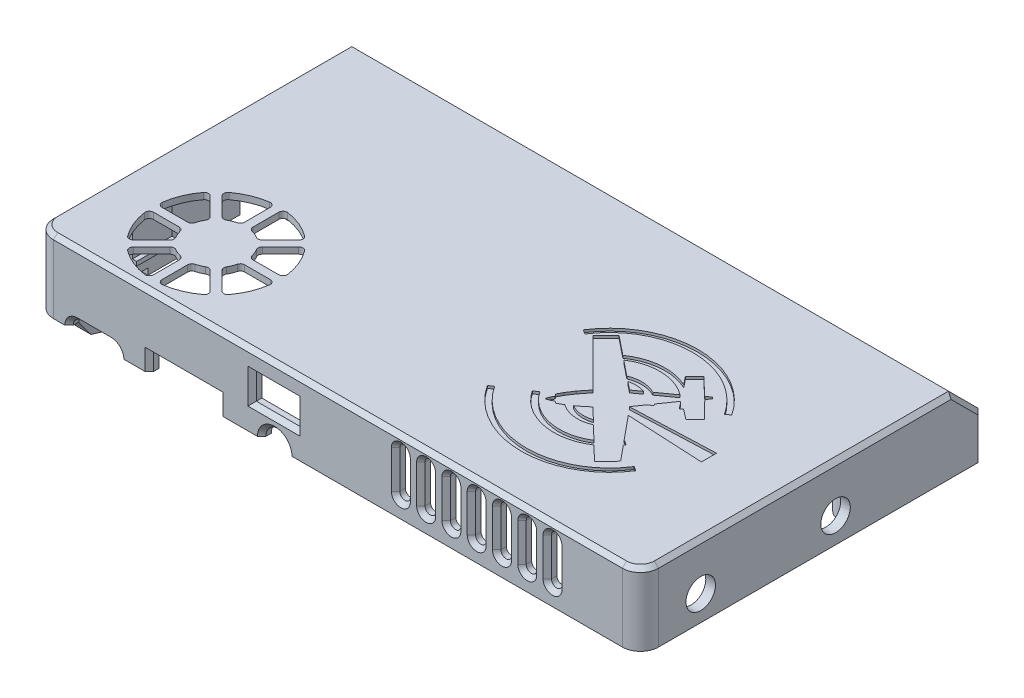
from build123d import *
from OCP.BRepFilletAPI import BRepFilletAPI_MakeChamfer

# Parameters (mm, degrees)
SKETCH3_W                      = 143.6
SKETCH3_H                      = 81.1
SKETCH3_W_2                    = 139
SKETCH3_H_2                    = 76.5
BOSS_EXTRUDE1_DEPTH            = 17.2
CUT_EXTRUDE1_REACH             = 113.702
SKETCH11_R                     = 3.1
SKETCH11_W                     = 12
SKETCH11_H                     = 2
SKETCH11_W_2                   = 16.5
SKETCH11_H_2                   = 4
SKETCH14_W                     = 2.3
SKETCH14_H                     = 30
BOSS_EXTRUDE6_DEPTH            = 2.8
SKETCH94_W                     = 2.3
SKETCH94_H                     = 13.507377528
BOSS_EXTRUDE11_DEPTH           = 1.5
SKETCH35_W                     = 139
SKETCH35_H                     = 76.5
BOSS_EXTRUDE7_DEPTH            = 2
CUT_EXTRUDE4_DEPTH             = 0.6
CUT_EXTRUDE5_DEPTH             = 0.6
BOSS_EXTRUDE9_START            = -17.2
SKETCH48_R                     = 4.3
BOSS_EXTRUDE9_DEPTH            = 15.2
BOSS_EXTRUDE10_DEPTH           = 18.3
FILLET15_R                     = 4.3
CUT_EXTRUDE19_REACH            = 155.999
SKETCH68_R                     = 3.5
CUT_EXTRUDE20_DEPTH            = 2.3
FILLET24_R                     = 2
FILLET25_R                     = 2
FILLET26_R                     = 2
CHAMFER1_SIZE                  = 1
FILLET51_R                     = 3
CHAMFER3_SIZE                  = 2
CHAMFER3_SIZE2                 = 2.965121937
F_2_3_2_3_DIAMETER_HOLE2_D     = 2.3
F_2_3_2_3_DIAMETER_HOLE2_DEPTH = 12
F_2_3_2_3_DIAMETER_HOLE1_D     = 2.3
F_2_3_2_3_DIAMETER_HOLE1_DEPTH = 13
CHAMFER4_SIZE                  = 1
CUT_EXTRUDE21_REACH            = 155.999
SKETCH95_W                     = 10
SKETCH95_H                     = 4
FILLET52_R                     = 1
CHAMFER5_SIZE                  = 1
SKETCH96_W                     = 30.5
SKETCH96_H                     = 30.5
CUT_EXTRUDE22_DEPTH            = 0.5
CUT_EXTRUDE23_REACH            = 95.826
SKETCH98_W                     = 2
SKETCH98_H                     = 9.383141043
BOSS_EXTRUDE12_DEPTH           = 7.5
SKETCH100_W                    = 9.383141043
SKETCH100_H                    = 1
BOSS_EXTRUDE13_DEPTH           = 1
SKETCH101_W                    = 9.383141043
SKETCH101_H                    = 1
BOSS_EXTRUDE14_DEPTH           = 1
SKETCH103_W                    = 139
SKETCH103_H                    = 1.5
BOSS_EXTRUDE24_DEPTH           = 15.2
CHAMFER6_SIZE                  = 1
CHAMFER7_SIZE                  = 1
SKETCH105_W                    = 2
SKETCH105_H                    = 18.5
BOSS_EXTRUDE25_DEPTH           = 15.2
SKETCH106_W                    = 1.127231504
SKETCH106_H                    = 6.675258223
SKETCH106_W_2                  = 1
SKETCH106_H_2                  = 18.5
BOSS_EXTRUDE26_DEPTH           = 8
CUT_EXTRUDE24_DEPTH            = 1.127231504
CUT_EXTRUDE25_START            = -1.127231504
CUT_EXTRUDE25_DEPTH            = 1.127231504
CHAMFER8_SIZE                  = 7
CHAMFER9_SIZE                  = 6
SKETCH115_W                    = 13
SKETCH115_H                    = 5
BOSS_EXTRUDE27_DEPTH           = 12
SKETCH116_R                    = 3.1
CUT_EXTRUDE29_DEPTH            = 100.406911394
SKETCH117_W                    = 10.361754238
SKETCH117_H                    = 6.2
CUT_EXTRUDE30_DEPTH            = 2.3
CHAMFER10_SIZE                 = 1
CHAMFER11_SIZE                 = 1
CHAMFER12_SIZE                 = 1


with BuildPart() as part:
    # Sketch3 → Boss-Extrude1 (new body)
    with BuildSketch(Plane(origin=(0, 0, 0), x_dir=(1, 0, 0), z_dir=(0, 1, 0))):
        with Locations((-3.061766162, 12.355993834)):
            Rectangle(SKETCH3_W, SKETCH3_H)
        with Locations((-3.061766162, 12.355993834)):
            Rectangle(SKETCH3_W_2, SKETCH3_H_2, mode=Mode.SUBTRACT)
    extrude(amount=BOSS_EXTRUDE1_DEPTH)

    # Sketch11 → Cut-Extrude1 (cut, up to next)
    with BuildSketch(Plane.XY.offset(28.194006166), mode=Mode.PRIVATE) as cut_extrude1_sk1:
        with Locations((-18.061766162, 0)):
            Circle(SKETCH11_R)
    cut_extrude1_tool1 = extrude(cut_extrude1_sk1.sketch, amount=-CUT_EXTRUDE1_REACH, mode=Mode.PRIVATE) & part.part
    # Sketch11 → Cut-Extrude1 (cut, up to next)
    with BuildSketch(Plane.XY.offset(28.194006166), mode=Mode.PRIVATE) as cut_extrude1_sk2:
        with Locations((-60.861766162, 1)):
            Rectangle(SKETCH11_W, SKETCH11_H)
    cut_extrude1_tool2 = extrude(cut_extrude1_sk2.sketch, amount=-CUT_EXTRUDE1_REACH, mode=Mode.PRIVATE) & part.part
    # Sketch11 → Cut-Extrude1 (cut, up to next)
    with BuildSketch(Plane.XY.offset(28.194006166), mode=Mode.PRIVATE) as cut_extrude1_sk3:
        with Locations((-39.561766162, 2)):
            Rectangle(SKETCH11_W_2, SKETCH11_H_2)
    cut_extrude1_tool3 = extrude(cut_extrude1_sk3.sketch, amount=-CUT_EXTRUDE1_REACH, mode=Mode.PRIVATE) & part.part
    add(cut_extrude1_tool1.solids().sort_by_distance((-18.061766, 0, 28.194006))[0], mode=Mode.SUBTRACT)
    add(cut_extrude1_tool2.solids().sort_by_distance((-60.861766, 1, 28.194006))[0], mode=Mode.SUBTRACT)
    add(cut_extrude1_tool3.solids().sort_by_distance((-39.561766, 2, 28.194006))[0], mode=Mode.SUBTRACT)

    # Sketch14 → Boss-Extrude6 (add)
    with BuildSketch(Plane.XZ):
        with Locations((-73.711766162, -3.105993834)):
            Rectangle(SKETCH14_W, SKETCH14_H)
    extrude(amount=BOSS_EXTRUDE6_DEPTH)

    # Sketch94 → Boss-Extrude11 (add)
    with BuildSketch(Plane.XZ.offset(2.8)):
        with Locations((-73.711766162, -2.986611136)):
            Rectangle(SKETCH94_W, SKETCH94_H)
    extrude(amount=BOSS_EXTRUDE11_DEPTH)

    # Sketch35 → Boss-Extrude7 (add)
    with BuildSketch(Plane(origin=(0, 17.2, 0), x_dir=(1, 0, 0), z_dir=(0, 1, 0))):
        with Locations((-3.061766162, 12.355993834)):
            Rectangle(SKETCH35_W, SKETCH35_H)
    extrude(amount=-BOSS_EXTRUDE7_DEPTH)

    # Sketch36 → Cut-Extrude4 (cut)
    with BuildSketch(Plane(origin=(0, 17.2, 0), x_dir=(1, 0, 0), z_dir=(0, 1, 0))):
        with BuildLine():
            Line((24.161779637, 0.392233192), (23.011912593, -0.357872059))
            ThreePointArc((23.011912593, -0.357872059), (29.415585328, -3.817531293), (35.804632502, -0.330936576))
            Line((35.804632502, -0.330936576), (34.651616926, 0.414319881))
            ThreePointArc((34.651616926, 0.414319881), (29.412694651, -2.444635175), (24.161779637, 0.392233192))
        make_face()
        with BuildLine():
            Line((24.14743779, 7.203740161), (22.994422214, 7.948996618))
            ThreePointArc((22.994422214, 7.948996618), (29.383469388, 11.435591335), (35.787142123, 7.975932102))
            Line((35.787142123, 7.975932102), (34.63727508, 7.22582685))
            ThreePointArc((34.63727508, 7.22582685), (29.386360065, 10.062695217), (24.14743779, 7.203740161))
        make_face()
        with BuildLine():
            Line((45.948925277, -6.887742795), (46.992328784, -7.562151032))
            ThreePointArc((46.992328784, -7.562151032), (29.443633532, -17.13872583), (11.854766481, -7.636134299))
            Line((11.854766481, -7.636134299), (12.895320773, -6.957338222))
            ThreePointArc((12.895320773, -6.957338222), (29.441017659, -15.896344847), (45.948925277, -6.887742795))
        make_face()
        with BuildLine():
            Line((39.41741464, -2.666073477), (40.524480414, -3.381630087))
            ThreePointArc((40.524480414, -3.381630087), (29.427418261, -9.437456131), (18.30495314, -3.428414016))
            Line((18.30495314, -3.428414016), (19.408995856, -2.708201846))
            ThreePointArc((19.408995856, -2.708201846), (29.424642783, -8.119272462), (39.41741464, -2.666073477))
        make_face()
        with BuildLine():
            Line((12.850129439, 14.505802837), (11.806725932, 15.180211074))
            ThreePointArc((11.806725932, 15.180211074), (29.355421185, 24.756785872), (46.944288235, 15.254194341))
            Line((46.944288235, 15.254194341), (45.903733944, 14.575398264))
            ThreePointArc((45.903733944, 14.575398264), (29.358037058, 23.51440489), (12.850129439, 14.505802837))
        make_face()
        with BuildLine():
            Line((19.381640076, 10.284133519), (18.274574303, 10.999690129))
            ThreePointArc((18.274574303, 10.999690129), (29.371636456, 17.055516173), (40.494101577, 11.046474058))
            Line((40.494101577, 11.046474058), (39.39005886, 10.326261888))
            ThreePointArc((39.39005886, 10.326261888), (29.374411934, 15.737332504), (19.381640076, 10.284133519))
        make_face()
        Polygon((52.970409368, 2.032871576), (31.272458716, 3.1100748), (31.272458716, 4.751527332), (52.970409368, 5.623548989), align=None)
    extrude(amount=-CUT_EXTRUDE4_DEPTH, mode=Mode.SUBTRACT)

    # Sketch37 → Cut-Extrude5 (cut)
    with BuildSketch(Plane(origin=(0, 17.2, 0), x_dir=(1, 0, 0), z_dir=(0, 1, 0))):
        Polygon((28.805009981, 0.4761393), (40.182569063, -10.556645264), (43.238384097, -7.405336011), (33.094377004, 4.899549043), (38.166380551, 12.198472901), (42.417591065, 8.902411722), (44.568940225, 11.120990543), (40.544894779, 15.266245054), (41.344156493, 16.297120883), (41.114611999, 16.475092003), (40.933368387, 16.702061489), (39.914056825, 15.888103135), (35.711539041, 19.852308098), (33.524030257, 17.669374175), (36.880698648, 13.465853336), (29.655237827, 8.289732648), (17.206191432, 18.256292734), (14.099014617, 15.155614134), (25.293775626, 3.93739182), (23.594988453, 1.815468092), (22.403600711, 0.012444552), (21.719985048, -1.305503792), (22.078414673, -1.805843596), (21.679059506, -2.575763756), (21.459015457, -3.268829783), (21.461778406, -3.461536167), (21.654504596, -3.461536167), (22.344344816, -3.231578841), (23.108460643, -2.821227033), (23.613887524, -3.172446882), (24.921900017, -2.470007184), (26.707658365, -1.252893484), align=None)
    extrude(amount=-CUT_EXTRUDE5_DEPTH, mode=Mode.SUBTRACT)

    # Sketch48 → Boss-Extrude9 (add)
    with BuildSketch(Plane(origin=(0, 17.2, 0), x_dir=(1, 0, 0), z_dir=(0, 1, 0)).offset(BOSS_EXTRUDE9_START)):
        with Locations((64.438233838, 27.805993834)):
            Circle(SKETCH48_R)
        with Locations((64.438233838, -23.894006166)):
            Circle(SKETCH48_R)
    extrude(amount=BOSS_EXTRUDE9_DEPTH)

    # Sketch87 → Boss-Extrude10 (add)
    with BuildSketch(Plane.XZ.offset(-15.2)):
        with BuildLine():
            ThreePointArc((-65.061766162, -27.605993834), (-65.940445819, -25.484673491), (-68.061766162, -24.605993834))
            Line((-68.061766162, -24.605993834), (-72.561766162, -24.605993834))
            Line((-72.561766162, -24.605993834), (-72.561766162, -30.605993834))
            Line((-72.561766162, -30.605993834), (-65.061766162, -30.605993834))
            Line((-65.061766162, -30.605993834), (-65.061766162, -27.605993834))
        make_face()
        with BuildLine():
            ThreePointArc((-7.061766162, -27.605993834), (-10.061766162, -24.605993834), (-13.061766162, -27.605993834))
            Line((-13.061766162, -27.605993834), (-13.061766162, -30.605993834))
            Line((-13.061766162, -30.605993834), (-7.061766162, -30.605993834))
            Line((-7.061766162, -30.605993834), (-7.061766162, -27.605993834))
        make_face()
        with BuildLine():
            Line((-13.061766162, 25.894006166), (-13.061766162, 21.394006166))
            ThreePointArc((-13.061766162, 21.394006166), (-10.061766162, 18.394006166), (-7.061766162, 21.394006166))
            Line((-7.061766162, 21.394006166), (-7.061766162, 25.894006166))
            Line((-7.061766162, 25.894006166), (-13.061766162, 25.894006166))
        make_face()
        with BuildLine():
            Line((-65.141523152, 22.08116027), (-66.861766162, 25.894006166))
            Line((-66.861766162, 25.894006166), (-72.561766162, 25.894006166))
            Line((-72.561766162, 25.894006166), (-72.561766162, 18.394006166))
            Line((-72.561766162, 18.394006166), (-68.061766162, 18.394006166))
            ThreePointArc((-68.061766162, 18.394006166), (-65.710015504, 19.531408828), (-65.141523152, 22.08116027))
        make_face()
    extrude(amount=BOSS_EXTRUDE10_DEPTH)

    # Fillet15
    fillet15_edges = [part.edges().sort_by_distance(p)[0] for p in [
        (68.738233838, 8.6, 28.194006166),
        (-74.861766162, 8.6, 28.194006166),
    ]]
    fillet(fillet15_edges, radius=FILLET15_R - 0.0001)  # a hair under: the kernel refuses the full size

    # Sketch68 → Cut-Extrude19 (cut, up to next)
    with BuildSketch(Plane(origin=(68.738233838, 0, 0), x_dir=(0, 0, -1), z_dir=(1, 0, 0)), mode=Mode.PRIVATE) as cut_extrude19_sk1:
        with Locations((-13.894006166, 6)):
            Circle(SKETCH68_R)
    cut_extrude19_tool1 = extrude(cut_extrude19_sk1.sketch, amount=-CUT_EXTRUDE19_REACH, mode=Mode.PRIVATE) & part.part
    # Sketch68 → Cut-Extrude19 (cut, up to next)
    with BuildSketch(Plane(origin=(68.738233838, 0, 0), x_dir=(0, 0, -1), z_dir=(1, 0, 0)), mode=Mode.PRIVATE) as cut_extrude19_sk2:
        with Locations((18.105993834, 6)):
            Circle(SKETCH68_R)
    cut_extrude19_tool2 = extrude(cut_extrude19_sk2.sketch, amount=-CUT_EXTRUDE19_REACH, mode=Mode.PRIVATE) & part.part
    add(cut_extrude19_tool1.solids().sort_by_distance((68.738234, 6, 13.894006))[0], mode=Mode.SUBTRACT)
    add(cut_extrude19_tool2.solids().sort_by_distance((68.738234, 6, -18.105994))[0], mode=Mode.SUBTRACT)

    # Sketch81 → Cut-Extrude20 (cut)
    with BuildSketch(Plane.XY.offset(28.194006166)):
        with BuildLine():
            Line((46.626025489, 4.603773013), (46.626025489, 13.603773013))
            ThreePointArc((46.626025489, 13.603773013), (47.876025489, 14.853773013), (49.126025489, 13.603773013))
            Line((49.126025489, 13.603773013), (49.126025489, 4.603773013))
            ThreePointArc((49.126025489, 4.603773013), (47.876025489, 3.353773013), (46.626025489, 4.603773013))
        make_face()
        with BuildLine():
            Line((40.626025489, 4.603773013), (40.626025489, 13.603773013))
            ThreePointArc((40.626025489, 13.603773013), (41.876025489, 14.853773013), (43.126025489, 13.603773013))
            Line((43.126025489, 13.603773013), (43.126025489, 4.603773013))
            ThreePointArc((43.126025489, 4.603773013), (41.876025489, 3.353773013), (40.626025489, 4.603773013))
        make_face()
        with BuildLine():
            Line((34.626025489, 4.603773013), (34.626025489, 13.603773013))
            ThreePointArc((34.626025489, 13.603773013), (35.876025489, 14.853773013), (37.126025489, 13.603773013))
            Line((37.126025489, 13.603773013), (37.126025489, 4.603773013))
            ThreePointArc((37.126025489, 4.603773013), (35.876025489, 3.353773013), (34.626025489, 4.603773013))
        make_face()
        with BuildLine():
            Line((28.626025489, 4.603773013), (28.626025489, 13.603773013))
            ThreePointArc((28.626025489, 13.603773013), (29.876025489, 14.853773013), (31.126025489, 13.603773013))
            Line((31.126025489, 13.603773013), (31.126025489, 4.603773013))
            ThreePointArc((31.126025489, 4.603773013), (29.876025489, 3.353773013), (28.626025489, 4.603773013))
        make_face()
        with BuildLine():
            Line((22.626025489, 4.603773013), (22.626025489, 13.603773013))
            ThreePointArc((22.626025489, 13.603773013), (23.876025489, 14.853773013), (25.126025489, 13.603773013))
            Line((25.126025489, 13.603773013), (25.126025489, 4.603773013))
            ThreePointArc((25.126025489, 4.603773013), (23.876025489, 3.353773013), (22.626025489, 4.603773013))
        make_face()
        with BuildLine():
            Line((16.626025489, 4.603773013), (16.626025489, 13.603773013))
            ThreePointArc((16.626025489, 13.603773013), (17.876025489, 14.853773013), (19.126025489, 13.603773013))
            Line((19.126025489, 13.603773013), (19.126025489, 4.603773013))
            ThreePointArc((19.126025489, 4.603773013), (17.876025489, 3.353773013), (16.626025489, 4.603773013))
        make_face()
        with BuildLine():
            Line((10.626025489, 4.603773013), (10.626025489, 13.603773013))
            ThreePointArc((10.626025489, 13.603773013), (11.876025489, 14.853773013), (13.126025489, 13.603773013))
            Line((13.126025489, 13.603773013), (13.126025489, 4.603773013))
            ThreePointArc((13.126025489, 4.603773013), (11.876025489, 3.353773013), (10.626025489, 4.603773013))
        make_face()
    extrude(amount=-CUT_EXTRUDE20_DEPTH, mode=Mode.SUBTRACT)

    # Fillet24
    fillet24_edges = [part.edges().sort_by_distance(p)[0] for p in [
        (60.631660576, 7.6, 25.894006166),
    ]]
    fillet(fillet24_edges, radius=FILLET24_R)

    # Fillet25
    fillet25_edges = [part.edges().sort_by_distance(p)[0] for p in [
        (-54.861766162, 2, 27.044006166),
    ]]
    fillet(fillet25_edges, radius=FILLET25_R - 0.0001)  # a hair under: the kernel refuses the full size

    # Fillet26
    fillet26_edges = [part.edges().sort_by_distance(p)[0] for p in [
        (-66.861766162, 2, 27.044006166),
    ]]
    fillet(fillet26_edges, radius=FILLET26_R - 0.0001)  # a hair under: the kernel refuses the full size

    # Chamfer1
    chamfer1_edges = [part.edges().sort_by_distance(p)[0] for p in [
        (-47.811766162, 2, 28.194006166),
        (-31.311766162, 2, 28.194006166),
        (-39.561766162, 4, 28.194006166),
        (-18.061766162, 3.1, 28.194006166),
        (-60.861766162, 2, 28.194006166),
        (-55.447523311, 1.414242852, 28.194006166),
        (-66.276009014, 1.414242852, 28.194006166),
    ]]
    chamfer(chamfer1_edges, length=CHAMFER1_SIZE)

    # Fillet51
    fillet51_edges = [part.edges().sort_by_distance(p)[0] for p in [
        (-72.561766162, -1.55, 25.894006166),
    ]]
    fillet(fillet51_edges, radius=FILLET51_R)

    # Chamfer3: one chamfer whose edges measure the first distance from different faces: ONE call of the kernel's chamfer builder (chamfer() names one face for all edges)
    chamfer3_edges_1 = [part.edges().sort_by_distance(p)[0] for p in [
        (-72.561766162, -3.1, 20.644006166),
        (-68.211766162, -3.1, 25.894006166),
        (-71.683086506, -3.1, 25.015326509),
    ]]
    chamfer3_side_1 = [part.faces().sort_by_distance(p)[0] for p in [
        (-69.044459611, -3.1, 21.965951724),
    ]]
    chamfer3_edges_2 = [part.edges().sort_by_distance(p)[0] for p in [
        (-10.061766162, -3.1, 25.894006166),
    ]]
    chamfer3_side_2 = [part.faces().sort_by_distance(p)[0] for p in [
        (-10.061766162, -3.1, 22.433212392),
    ]]
    chamfer3_edges_3 = [part.edges().sort_by_distance(p)[0] for p in [
        (-72.561766162, -3.1, -27.605993834),
    ]]
    chamfer3_side_3 = [part.faces().sort_by_distance(p)[0] for p in [
        (-68.949884529, -3.1, -27.710478348),
    ]]
    chamfer3 = BRepFilletAPI_MakeChamfer(part.part.solid().wrapped)
    for e in chamfer3_edges_1:
        chamfer3.Add(CHAMFER3_SIZE, CHAMFER3_SIZE2, e.wrapped, chamfer3_side_1[0].wrapped)  # the first distance lies on this face
    for e in chamfer3_edges_2:
        chamfer3.Add(CHAMFER3_SIZE, CHAMFER3_SIZE2, e.wrapped, chamfer3_side_2[0].wrapped)  # the first distance lies on this face
    for e in chamfer3_edges_3:
        chamfer3.Add(CHAMFER3_SIZE, CHAMFER3_SIZE2, e.wrapped, chamfer3_side_3[0].wrapped)  # the first distance lies on this face
    add(Compound.cast(chamfer3.Shape()), mode=Mode.REPLACE)

    # Ø2.3 (2.3) Diameter Hole2
    with Locations(Plane(origin=(0, 0, 0), x_dir=(-1, 0, 0), z_dir=(0, -1, 0))):
        with Locations((-64.438233838, -23.894006166), (-64.438233838, 27.805993834)):
            Hole(F_2_3_2_3_DIAMETER_HOLE2_D / 2, depth=F_2_3_2_3_DIAMETER_HOLE2_DEPTH)

    # Ø2.3 (2.3) Diameter Hole1
    with Locations(Plane(origin=(0, -3.1, 0), x_dir=(-1, 0, 0), z_dir=(0, -1, 0))):
        with Locations((68.061766162, -21.394006166), (68.061766162, 27.605993834), (10.061766162, 27.605993834), (10.061766162, -21.394006166)):
            Hole(F_2_3_2_3_DIAMETER_HOLE1_D / 2, depth=F_2_3_2_3_DIAMETER_HOLE1_DEPTH)

    # Chamfer4
    chamfer4_edges = [part.edges().sort_by_distance(p)[0] for p in [
        (-74.861766162, -4.3, -2.986611136),
    ]]
    chamfer(chamfer4_edges, length=CHAMFER4_SIZE)

    # Sketch95 → Cut-Extrude21 (cut, up to next)
    with BuildSketch(Plane.ZY.offset(74.861766162), mode=Mode.PRIVATE) as cut_extrude21_sk1:
        with Locations((-18.605993834, 11.2)):
            Rectangle(SKETCH95_W, SKETCH95_H)
    cut_extrude21_tool1 = extrude(cut_extrude21_sk1.sketch, amount=-CUT_EXTRUDE21_REACH, mode=Mode.PRIVATE) & part.part
    add(cut_extrude21_tool1.solids().sort_by_distance((-74.861766, 11.2, -18.605994))[0], mode=Mode.SUBTRACT)

    # Fillet52
    fillet52_edges = [part.edges().sort_by_distance(p)[0] for p in [
        (-73.711766162, 13.2, -13.605993834),
        (-73.711766162, 9.2, -13.605993834),
        (-73.711766162, 9.2, -23.605993834),
        (-73.711766162, 13.2, -23.605993834),
    ]]
    fillet(fillet52_edges, radius=FILLET52_R)

    # Chamfer5
    chamfer5_edges = [part.edges().sort_by_distance(p)[0] for p in [
        (-74.861766162, 9.2, -18.605993834),
        (-74.861766162, 11.2, -23.605993834),
        (-74.861766162, 11.2, -13.605993834),
        (-74.861766162, 13.2, -18.605993834),
        (-74.861766162, 9.492893219, -23.313100616),
        (-74.861766162, 9.492893219, -13.898887053),
        (-74.861766162, 12.907106781, -13.898887053),
        (-74.861766162, 12.907106781, -23.313100616),
    ]]
    chamfer(chamfer5_edges, length=CHAMFER5_SIZE)

    # Sketch96 → Cut-Extrude22 (cut)
    with BuildSketch(Plane.XZ.offset(-15.2)):
        with Locations((-49.504925423, 10.644006166)):
            Rectangle(SKETCH96_W, SKETCH96_H)
    extrude(amount=-CUT_EXTRUDE22_DEPTH, mode=Mode.SUBTRACT)

    # Sketch97 → Cut-Extrude23 (cut, up to next)
    with BuildSketch(Plane.XZ.offset(-15.7), mode=Mode.PRIVATE) as cut_extrude23_sk1:
        with BuildLine():
            Line((-48.504925423, 18.389972858), (-48.504925423, 24.500412626))
            ThreePointArc((-48.504925423, 24.500412626), (-48.159579094, 25.256341572), (-47.36206828, 25.490155945))
            ThreePointArc((-47.36206828, 25.490155945), (-43.764673938, 24.502199153), (-40.522341057, 22.657048166))
            ThreePointArc((-40.522341057, 22.657048166), (-40.123747481, 21.927791133), (-40.414073233, 21.149071918))
            Line((-40.414073233, 21.149071918), (-44.734806629, 16.828338522))
            ThreePointArc((-44.734806629, 16.828338522), (-45.315909118, 16.543415607), (-45.949789912, 16.674015411))
            ThreePointArc((-45.949789912, 16.674015411), (-46.826141397, 17.111162893), (-47.754925423, 17.421727022))
            ThreePointArc((-47.754925423, 17.421727022), (-48.295494838, 17.777600422), (-48.504925423, 18.389972858))
        make_face()
    cut_extrude23_tool1 = extrude(cut_extrude23_sk1.sketch, amount=-CUT_EXTRUDE23_REACH, mode=Mode.PRIVATE) & part.part
    # Sketch97 → Cut-Extrude23 (cut, up to next)
    with BuildSketch(Plane.XZ.offset(-15.7), mode=Mode.PRIVATE) as cut_extrude23_sk2:
        with BuildLine():
            Line((-50.504925423, 18.389972858), (-50.504925423, 24.500412626))
            ThreePointArc((-50.504925423, 24.500412626), (-50.850271752, 25.256341572), (-51.647782566, 25.490155945))
            ThreePointArc((-51.647782566, 25.490155945), (-55.245176909, 24.502199153), (-58.48750979, 22.657048166))
            ThreePointArc((-58.48750979, 22.657048166), (-58.886103366, 21.927791133), (-58.595777613, 21.149071918))
            Line((-58.595777613, 21.149071918), (-54.275044217, 16.828338522))
            ThreePointArc((-54.275044217, 16.828338522), (-53.693941728, 16.543415607), (-53.060060934, 16.674015411))
            ThreePointArc((-53.060060934, 16.674015411), (-52.18370945, 17.111162893), (-51.254925423, 17.421727022))
            ThreePointArc((-51.254925423, 17.421727022), (-50.714356008, 17.777600422), (-50.504925423, 18.389972858))
        make_face()
    cut_extrude23_tool2 = extrude(cut_extrude23_sk2.sketch, amount=-CUT_EXTRUDE23_REACH, mode=Mode.PRIVATE) & part.part
    # Sketch97 → Cut-Extrude23 (cut, up to next)
    with BuildSketch(Plane.XZ.offset(-15.7), mode=Mode.PRIVATE) as cut_extrude23_sk3:
        with BuildLine():
            Line((-43.320593067, 15.41412496), (-38.999859671, 19.734858356))
            ThreePointArc((-38.999859671, 19.734858356), (-38.221140456, 20.025184108), (-37.491883423, 19.626590532))
            ThreePointArc((-37.491883423, 19.626590532), (-35.646732435, 16.384257651), (-34.658775644, 12.786863309))
            ThreePointArc((-34.658775644, 12.786863309), (-34.892590017, 11.989352495), (-35.648518963, 11.644006166))
            Line((-35.648518963, 11.644006166), (-41.758958731, 11.644006166))
            ThreePointArc((-41.758958731, 11.644006166), (-42.371331166, 11.853436751), (-42.727204567, 12.394006166))
            ThreePointArc((-42.727204567, 12.394006166), (-43.037768696, 13.322790192), (-43.474916178, 14.199141677))
            ThreePointArc((-43.474916178, 14.199141677), (-43.605515982, 14.833022471), (-43.320593067, 15.41412496))
        make_face()
    cut_extrude23_tool3 = extrude(cut_extrude23_sk3.sketch, amount=-CUT_EXTRUDE23_REACH, mode=Mode.PRIVATE) & part.part
    # Sketch97 → Cut-Extrude23 (cut, up to next)
    with BuildSketch(Plane.XZ.offset(-15.7), mode=Mode.PRIVATE) as cut_extrude23_sk4:
        with BuildLine():
            Line((-41.758958731, 9.644006166), (-35.648518963, 9.644006166))
            ThreePointArc((-35.648518963, 9.644006166), (-34.892590017, 9.298659836), (-34.658775644, 8.501149023))
            ThreePointArc((-34.658775644, 8.501149023), (-35.646732435, 4.90375468), (-37.491883423, 1.661421799))
            ThreePointArc((-37.491883423, 1.661421799), (-38.221140456, 1.262828223), (-38.999859671, 1.553153976))
            Line((-38.999859671, 1.553153976), (-43.320593067, 5.873887372))
            ThreePointArc((-43.320593067, 5.873887372), (-43.605515982, 6.454989861), (-43.474916178, 7.088870655))
            ThreePointArc((-43.474916178, 7.088870655), (-43.037768696, 7.965222139), (-42.727204567, 8.894006166))
            ThreePointArc((-42.727204567, 8.894006166), (-42.371331166, 9.434575581), (-41.758958731, 9.644006166))
        make_face()
    cut_extrude23_tool4 = extrude(cut_extrude23_sk4.sketch, amount=-CUT_EXTRUDE23_REACH, mode=Mode.PRIVATE) & part.part
    # Sketch97 → Cut-Extrude23 (cut, up to next)
    with BuildSketch(Plane.XZ.offset(-15.7), mode=Mode.PRIVATE) as cut_extrude23_sk5:
        with BuildLine():
            Line((-44.734806629, 4.459673809), (-40.414073233, 0.138940413))
            ThreePointArc((-40.414073233, 0.138940413), (-40.123747481, -0.639778802), (-40.522341057, -1.369035835))
            ThreePointArc((-40.522341057, -1.369035835), (-43.764673938, -3.214186822), (-47.36206828, -4.202143613))
            ThreePointArc((-47.36206828, -4.202143613), (-48.159579094, -3.968329241), (-48.504925423, -3.212400295))
            Line((-48.504925423, -3.212400295), (-48.504925423, 2.898039473))
            ThreePointArc((-48.504925423, 2.898039473), (-48.295494838, 3.510411909), (-47.754925423, 3.86628531))
            ThreePointArc((-47.754925423, 3.86628531), (-46.826141397, 4.176849438), (-45.949789912, 4.61399692))
            ThreePointArc((-45.949789912, 4.61399692), (-45.315909118, 4.744596725), (-44.734806629, 4.459673809))
        make_face()
    cut_extrude23_tool5 = extrude(cut_extrude23_sk5.sketch, amount=-CUT_EXTRUDE23_REACH, mode=Mode.PRIVATE) & part.part
    # Sketch97 → Cut-Extrude23 (cut, up to next)
    with BuildSketch(Plane.XZ.offset(-15.7), mode=Mode.PRIVATE) as cut_extrude23_sk6:
        with BuildLine():
            Line((-50.504925423, 2.898039473), (-50.504925423, -3.212400295))
            ThreePointArc((-50.504925423, -3.212400295), (-50.850271752, -3.968329241), (-51.647782566, -4.202143613))
            ThreePointArc((-51.647782566, -4.202143613), (-55.245176909, -3.214186822), (-58.48750979, -1.369035835))
            ThreePointArc((-58.48750979, -1.369035835), (-58.886103366, -0.639778802), (-58.595777613, 0.138940413))
            Line((-58.595777613, 0.138940413), (-54.275044217, 4.459673809))
            ThreePointArc((-54.275044217, 4.459673809), (-53.693941728, 4.744596725), (-53.060060934, 4.61399692))
            ThreePointArc((-53.060060934, 4.61399692), (-52.18370945, 4.176849438), (-51.254925423, 3.86628531))
            ThreePointArc((-51.254925423, 3.86628531), (-50.714356008, 3.510411909), (-50.504925423, 2.898039473))
        make_face()
    cut_extrude23_tool6 = extrude(cut_extrude23_sk6.sketch, amount=-CUT_EXTRUDE23_REACH, mode=Mode.PRIVATE) & part.part
    # Sketch97 → Cut-Extrude23 (cut, up to next)
    with BuildSketch(Plane.XZ.offset(-15.7), mode=Mode.PRIVATE) as cut_extrude23_sk7:
        with BuildLine():
            Line((-55.689257779, 5.873887372), (-60.009991175, 1.553153976))
            ThreePointArc((-60.009991175, 1.553153976), (-60.788710391, 1.262828223), (-61.517967423, 1.661421799))
            ThreePointArc((-61.517967423, 1.661421799), (-63.363118411, 4.90375468), (-64.351075202, 8.501149023))
            ThreePointArc((-64.351075202, 8.501149023), (-64.11726083, 9.298659836), (-63.361331884, 9.644006166))
            Line((-63.361331884, 9.644006166), (-57.250892116, 9.644006166))
            ThreePointArc((-57.250892116, 9.644006166), (-56.63851968, 9.434575581), (-56.282646279, 8.894006166))
            ThreePointArc((-56.282646279, 8.894006166), (-55.972082151, 7.965222139), (-55.534934668, 7.088870655))
            ThreePointArc((-55.534934668, 7.088870655), (-55.404334864, 6.454989861), (-55.689257779, 5.873887372))
        make_face()
    cut_extrude23_tool7 = extrude(cut_extrude23_sk7.sketch, amount=-CUT_EXTRUDE23_REACH, mode=Mode.PRIVATE) & part.part
    # Sketch97 → Cut-Extrude23 (cut, up to next)
    with BuildSketch(Plane.XZ.offset(-15.7), mode=Mode.PRIVATE) as cut_extrude23_sk8:
        with BuildLine():
            Line((-57.250892116, 11.644006166), (-63.361331884, 11.644006166))
            ThreePointArc((-63.361331884, 11.644006166), (-64.11726083, 11.989352495), (-64.351075202, 12.786863309))
            ThreePointArc((-64.351075202, 12.786863309), (-63.363118411, 16.384257651), (-61.517967423, 19.626590532))
            ThreePointArc((-61.517967423, 19.626590532), (-60.788710391, 20.025184108), (-60.009991175, 19.734858356))
            Line((-60.009991175, 19.734858356), (-55.689257779, 15.41412496))
            ThreePointArc((-55.689257779, 15.41412496), (-55.404334864, 14.833022471), (-55.534934668, 14.199141677))
            ThreePointArc((-55.534934668, 14.199141677), (-55.972082151, 13.322790192), (-56.282646279, 12.394006166))
            ThreePointArc((-56.282646279, 12.394006166), (-56.63851968, 11.853436751), (-57.250892116, 11.644006166))
        make_face()
    cut_extrude23_tool8 = extrude(cut_extrude23_sk8.sketch, amount=-CUT_EXTRUDE23_REACH, mode=Mode.PRIVATE) & part.part
    add(cut_extrude23_tool1.solids().sort_by_distance((-45.125774, 15.7, 21.216213))[0], mode=Mode.SUBTRACT)
    add(cut_extrude23_tool2.solids().sort_by_distance((-53.884077, 15.7, 21.216213))[0], mode=Mode.SUBTRACT)
    add(cut_extrude23_tool3.solids().sort_by_distance((-38.932718, 15.7, 15.023158))[0], mode=Mode.SUBTRACT)
    add(cut_extrude23_tool4.solids().sort_by_distance((-38.932718, 15.7, 6.264855))[0], mode=Mode.SUBTRACT)
    add(cut_extrude23_tool5.solids().sort_by_distance((-45.125774, 15.7, 0.071799))[0], mode=Mode.SUBTRACT)
    add(cut_extrude23_tool6.solids().sort_by_distance((-53.884077, 15.7, 0.071799))[0], mode=Mode.SUBTRACT)
    add(cut_extrude23_tool7.solids().sort_by_distance((-60.077133, 15.7, 6.264855))[0], mode=Mode.SUBTRACT)
    add(cut_extrude23_tool8.solids().sort_by_distance((-60.077133, 15.7, 15.023158))[0], mode=Mode.SUBTRACT)

    # Sketch98 → Boss-Extrude12 (add)
    with BuildSketch(Plane.XZ.offset(-15.2)):
        with Locations((-65.754925423, 10.573768169)):
            Rectangle(SKETCH98_W, SKETCH98_H)
        with Locations((-33.254925423, 10.644006166)):
            Rectangle(SKETCH98_W, SKETCH98_H)
    extrude(amount=BOSS_EXTRUDE12_DEPTH)

    # Sketch100 → Boss-Extrude13 (add)
    with BuildSketch(Plane(origin=(-64.754925423, 0, 0), x_dir=(0, 0, -1), z_dir=(1, 0, 0))):
        with Locations((-10.573768169, 8.2)):
            Rectangle(SKETCH100_W, SKETCH100_H)
    extrude(amount=BOSS_EXTRUDE13_DEPTH)

    # Sketch101 → Boss-Extrude14 (add)
    with BuildSketch(Plane.ZY.offset(34.254925423)):
        with Locations((10.644006166, 8.2)):
            Rectangle(SKETCH101_W, SKETCH101_H)
    extrude(amount=BOSS_EXTRUDE14_DEPTH)

    # Sketch103 → Boss-Extrude24 (add)
    with BuildSketch(Plane.XZ.offset(-15.2)):
        with Locations((-3.061766162, -31.355993834)):
            Rectangle(SKETCH103_W, SKETCH103_H)
    extrude(amount=BOSS_EXTRUDE24_DEPTH)

    # Chamfer6
    chamfer6_edges = [part.edges().sort_by_distance(p)[0] for p in [
        (47.876025489, 3.353773013, 28.194006166),
        (49.126025489, 9.103773013, 28.194006166),
        (47.876025489, 14.853773013, 28.194006166),
        (46.626025489, 9.103773013, 28.194006166),
        (41.876025489, 3.353773013, 28.194006166),
        (43.126025489, 9.103773013, 28.194006166),
        (41.876025489, 14.853773013, 28.194006166),
        (40.626025489, 9.103773013, 28.194006166),
        (35.876025489, 3.353773013, 28.194006166),
        (37.126025489, 9.103773013, 28.194006166),
        (35.876025489, 14.853773013, 28.194006166),
        (34.626025489, 9.103773013, 28.194006166),
        (29.876025489, 3.353773013, 28.194006166),
        (31.126025489, 9.103773013, 28.194006166),
        (29.876025489, 14.853773013, 28.194006166),
        (28.626025489, 9.103773013, 28.194006166),
        (23.876025489, 3.353773013, 28.194006166),
        (25.126025489, 9.103773013, 28.194006166),
        (23.876025489, 14.853773013, 28.194006166),
        (22.626025489, 9.103773013, 28.194006166),
        (17.876025489, 3.353773013, 28.194006166),
        (19.126025489, 9.103773013, 28.194006166),
        (17.876025489, 14.853773013, 28.194006166),
        (16.626025489, 9.103773013, 28.194006166),
        (11.876025489, 3.353773013, 28.194006166),
        (13.126025489, 9.103773013, 28.194006166),
        (11.876025489, 14.853773013, 28.194006166),
        (10.626025489, 9.103773013, 28.194006166),
    ]]
    chamfer(chamfer6_edges, length=CHAMFER6_SIZE)

    # Chamfer7
    chamfer7_edges = [part.edges().sort_by_distance(p)[0] for p in [
        (-74.861766162, 17.2, -14.505943834),
        (-3.061766162, 17.2, 28.194006166),
        (68.738233838, 17.2, -14.505943834),
        (67.478822286, 17.2, 26.934594614),
        (-73.602354611, 17.2, 26.934594614),
    ]]
    chamfer(chamfer7_edges, length=CHAMFER7_SIZE)

    # Sketch105 → Boss-Extrude25 (add)
    with BuildSketch(Plane.XZ):
        with Locations((-3.061766162, -41.355993834)):
            Rectangle(SKETCH105_W, SKETCH105_H)
    extrude(amount=-BOSS_EXTRUDE25_DEPTH)

    # Sketch106 → Boss-Extrude26 (add)
    with BuildSketch(Plane.XZ):
        Polygon((64.065465342, -32.105993834), (64.065465342, -38.018364723), (64.065465342, -44.693622946), (64.065465342, -50.605993834), (65.065465342, -50.605993834), (65.065465342, -32.105993834), align=None)
        with Locations((63.50184959, -41.355993835)):
            Rectangle(SKETCH106_W, SKETCH106_H)
        with Locations((-69.625381914, -41.355993835)):
            Rectangle(SKETCH106_W, SKETCH106_H)
        with Locations((-70.688997666, -41.355993834)):
            Rectangle(SKETCH106_W_2, SKETCH106_H_2)
    extrude(amount=-BOSS_EXTRUDE26_DEPTH)

    # Sketch107 → Cut-Extrude24 (cut)
    with BuildSketch(Plane(origin=(-69.061766162, 0, 0), x_dir=(0, 0, -1), z_dir=(1, 0, 0))):
        with BuildLine():
            Line((38.018364723, 4), (38.018364723, 0))
            Line((38.018364723, 0), (44.693622946, 0))
            Line((44.693622946, 0), (44.693622946, 4))
            ThreePointArc((44.693622946, 4), (41.355993834, 0.662370889), (38.018364723, 4))
        make_face()
        with BuildLine():
            Line((38.018364723, 8), (38.018364723, 4))
            ThreePointArc((38.018364723, 4), (41.355993834, 7.337629111), (44.693622946, 4))
            Line((44.693622946, 4), (44.693622946, 8))
            Line((44.693622946, 8), (38.018364723, 8))
        make_face()
    extrude(amount=-CUT_EXTRUDE24_DEPTH, mode=Mode.SUBTRACT)

    # Sketch108 → Cut-Extrude25 (cut)
    with BuildSketch(Plane.ZY.offset(-62.938233838).offset(CUT_EXTRUDE25_START)):
        with BuildLine():
            Line((-44.693622946, 0), (-38.018364723, 0))
            Line((-38.018364723, 0), (-38.018364723, 4))
            ThreePointArc((-38.018364723, 4), (-41.355993834, 0.662370889), (-44.693622946, 4))
            Line((-44.693622946, 4), (-44.693622946, 0))
        make_face()
        with BuildLine():
            ThreePointArc((-44.693622946, 4), (-41.355993834, 7.337629111), (-38.018364723, 4))
            Line((-38.018364723, 4), (-38.018364723, 8))
            Line((-38.018364723, 8), (-44.693622946, 8))
            Line((-44.693622946, 8), (-44.693622946, 4))
        make_face()
    extrude(amount=CUT_EXTRUDE25_DEPTH, mode=Mode.SUBTRACT)

    # Chamfer8
    chamfer8_edges = [part.edges().sort_by_distance(p)[0] for p in [
        (-3.061766162, 17.2, -52.905993834),
    ]]
    chamfer(chamfer8_edges, length=CHAMFER8_SIZE)

    # Chamfer9
    chamfer9_edges = [part.edges().sort_by_distance(p)[0] for p in [
        (-38.311766162, 15.2, -50.605993834),
        (32.188233838, 15.2, -50.605993834),
    ]]
    chamfer(chamfer9_edges, length=CHAMFER9_SIZE)

    # Sketch115 → Boss-Extrude27 (add)
    with BuildSketch(Plane.XZ.offset(-15.2)):
        with Locations((-18.242643281, 12.694006166)):
            Rectangle(SKETCH115_W, SKETCH115_H)
    extrude(amount=BOSS_EXTRUDE27_DEPTH)

    # Sketch116 → Cut-Extrude29 (cut, through all)
    with BuildSketch(Plane(origin=(0, 0, 10.194006166), x_dir=(-1, 0, 0), z_dir=(0, 0, -1))):
        with Locations((18.242643281, 9.2)):
            Circle(SKETCH116_R)
    extrude(amount=-CUT_EXTRUDE29_DEPTH, mode=Mode.SUBTRACT)

    # Sketch117 → Cut-Extrude30 (cut)
    with BuildSketch(Plane(origin=(0, 0, 25.894006166), x_dir=(-1, 0, 0), z_dir=(0, 0, -1))):
        with Locations((18.242643281, 9.2)):
            Rectangle(SKETCH117_W, SKETCH117_H)
    extrude(amount=-CUT_EXTRUDE30_DEPTH, mode=Mode.SUBTRACT)

    # Chamfer10
    chamfer10_edges = [part.edges().sort_by_distance(p)[0] for p in [
        (-18.242643281, 6.1, 28.194006166),
        (-13.061766162, 9.2, 28.194006166),
        (-18.242643281, 12.3, 28.194006166),
        (-23.4235204, 9.2, 28.194006166),
    ]]
    chamfer(chamfer10_edges, length=CHAMFER10_SIZE)

    # Chamfer11
    chamfer11_edges = [part.edges().sort_by_distance(p)[0] for p in [
        (-24.742643281, 3.2, 12.694006166),
        (-11.742643281, 3.2, 12.694006166),
    ]]
    chamfer(chamfer11_edges, length=CHAMFER11_SIZE)

    # Chamfer12
    chamfer12_edges = [part.edges().sort_by_distance(p)[0] for p in [
        (68.738233838, 5.1, -52.905993834),
        (68.738233838, 13.2, -49.905993834),
        (-74.861766162, 5.1, -52.905993834),
        (-74.861766162, 13.2, -49.905993834),
    ]]
    chamfer(chamfer12_edges, length=CHAMFER12_SIZE - 0.0001)  # a hair under: the kernel refuses the full size


solid = part.part
